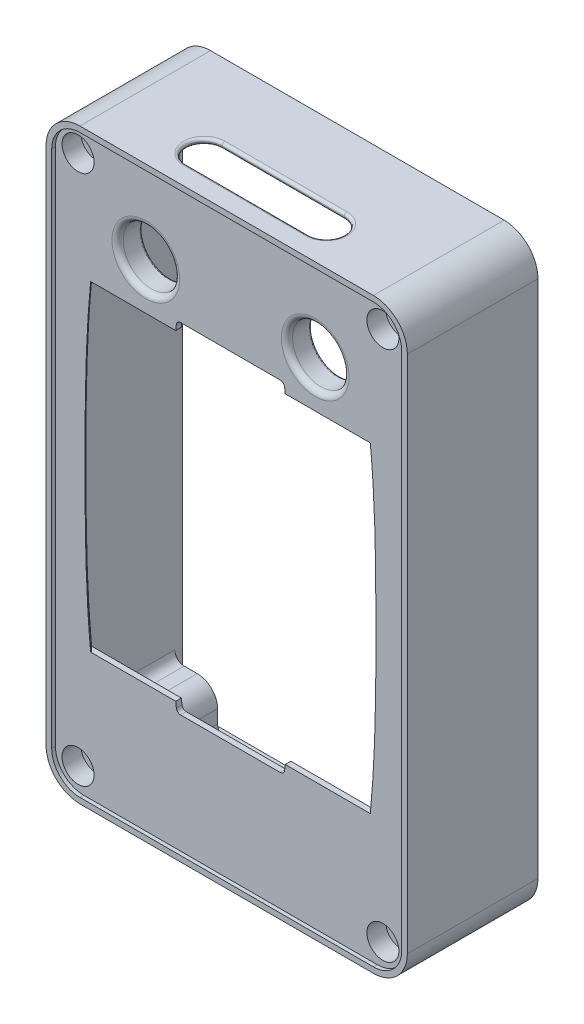
from build123d import *

# Parameters (mm, degrees)
EXTRUDE_THIN1_DEPTH      = 2
EXTRUDE_THIN1_DEPTH_BACK = 67.4
BOSS_EXTRUDE1_START      = -3
BOSS_EXTRUDE1_DEPTH      = 3
CUT_EXTRUDE1_DEPTH       = 196.178789831
BOSS_EXTRUDE2_START      = -63.4
BOSS_EXTRUDE2_DEPTH      = 63.4
SKETCH7_R                = 8.5
CUT_EXTRUDE2_DEPTH       = 10
SKETCH8_R                = 4.5
CUT_EXTRUDE3_DEPTH       = 192.955098916
MIRROR2_START            = -63.4
MIRROR2_COPY_1_DEPTH     = 63.4
MIRROR2_COPY_2_SKETCH_R  = 8.5
MIRROR2_COPY_2_DEPTH     = 10
MIRROR2_COPY_3_SKETCH_R  = 4.5
MIRROR2_COPY_3_DEPTH     = 192.955098916
FILLET1_R                = 5
SKETCH9_R                = 15
CUT_EXTRUDE4_DEPTH       = 30
SKETCH10_R               = 18
SKETCH10_R_2             = 15
BOSS_EXTRUDE3_DEPTH      = 10
FILLET2_R                = 3
CHAMFER1_SIZE            = 2.5
FILLET3_R                = 1
CUT_EXTRUDE5_DEPTH       = 10
FILLET4_R                = 1.5


with BuildPart() as part:
    # Sketch1 → Extrude-Thin1 (new, two sides: drawn at the far end of the back side and taken through both)
    with BuildSketch(Plane.XY.offset(-EXTRUDE_THIN1_DEPTH_BACK)):
        with BuildLine():
            Line((96, -138), (96, 138))
            ThreePointArc((96, 138), (90.727922061, 150.727922061), (78, 156))
            Line((78, 156), (-78, 156))
            ThreePointArc((-78, 156), (-90.727922061, 150.727922061), (-96, 138))
            Line((-96, 138), (-96, -138))
            ThreePointArc((-96, -138), (-90.727922061, -150.727922061), (-78, -156))
            Line((-78, -156), (78, -156))
            ThreePointArc((78, -156), (90.727922061, -150.727922061), (96, -138))
        make_face()
        with BuildLine():
            Line((93, -138), (93, 138))
            ThreePointArc((93, 138), (88.606601718, 148.606601718), (78, 153))
            Line((78, 153), (-78, 153))
            ThreePointArc((-78, 153), (-88.606601718, 148.606601718), (-93, 138))
            Line((-93, 138), (-93, -138))
            ThreePointArc((-93, -138), (-88.606601718, -148.606601718), (-78, -153))
            Line((-78, -153), (78, -153))
            ThreePointArc((78, -153), (88.606601718, -148.606601718), (93, -138))
        make_face(mode=Mode.SUBTRACT)
    extrude(amount=EXTRUDE_THIN1_DEPTH + EXTRUDE_THIN1_DEPTH_BACK)

    # Sketch2 → Boss-Extrude1 (add)
    with BuildSketch(Plane.XY.offset(BOSS_EXTRUDE1_START)):
        with BuildLine():
            Line((-78, -153), (78, -153))
            ThreePointArc((78, -153), (88.606601718, -148.606601718), (93, -138))
            Line((93, -138), (93, 138))
            ThreePointArc((93, 138), (88.606601718, 148.606601718), (78, 153))
            Line((78, 153), (-78, 153))
            ThreePointArc((-78, 153), (-88.606601718, 148.606601718), (-93, 138))
            Line((-93, 138), (-93, -138))
            ThreePointArc((-93, -138), (-88.606601718, -148.606601718), (-78, -153))
        make_face()
    extrude(amount=BOSS_EXTRUDE1_DEPTH)

    # Sketch3 → Cut-Extrude1 (cut, through all)
    with BuildSketch(Plane.XY):
        with BuildLine():
            Line((-26.486425646, -90.3), (26.486744093, -90.299999898))
            ThreePointArc((26.486744093, -90.299999898), (28.018686465, -89.713355324), (28.769359058, -88.254763685))
            Line((28.769359058, -88.254763685), (29.092842195, -85.299999997))
            Line((29.092842195, -85.299999997), (74.323776212, -85.299999479))
            add(Edge.make_bspline(
                [(74.323776212, -85.299999479), (74.664257065, -81.758054802), (74.972523643, -78.21369485), (75.517229034, -71.119589639), (75.755451691, -67.569978124), (76.375603408, -56.914057194), (76.663322985, -49.803573676), (77.058001321, -35.577505512), (77.166220385, -28.461936829), (77.286847677, -14.231427475), (77.299904168, -7.115770874), (77.3, -4.04e-06)],
                knots=[0, 0, 0, 0, 0.125, 0.125, 0.25, 0.25, 0.5, 0.5, 0.75, 0.75, 1, 1, 1, 1], degree=3))
            add(Edge.make_bspline(
                [(77.3, -4.04e-06), (77.29990407, 7.116423452), (77.286848245, 14.232799101), (77.166179901, 28.465172141), (77.057940161, 35.58070197), (76.663178374, 49.807811524), (76.37536408, 56.918515451), (75.755377557, 67.570985118), (75.517087768, 71.119815043), (74.972390534, 78.213181848), (74.664296315, 81.757612422), (74.323779506, 85.299999595)],
                knots=[0, 0, 0, 0, 0.25, 0.25, 0.5, 0.5, 0.75, 0.75, 0.875, 0.875, 1, 1, 1, 1], degree=3))
            Line((74.323779506, 85.299999595), (29.092842195, 85.299999998))
            Line((29.092842195, 85.299999998), (28.769307233, 88.255233671))
            ThreePointArc((28.769307233, 88.255233671), (28.018418083, 89.713595759), (26.486496265, 90.3))
            Line((26.486496265, 90.3), (-26.4866733, 90.299999898))
            ThreePointArc((-26.4866733, 90.299999898), (-28.018618582, 89.713354271), (-28.769291052, 88.254759089))
            Line((-28.769291052, 88.254759089), (-29.092772302, 85.299999997))
            Line((-29.092772302, 85.299999997), (-74.323776212, 85.299999479))
            add(Edge.make_bspline(
                [(-74.323776212, 85.299999479), (-74.664257065, 81.758054802), (-74.972523644, 78.21369485), (-75.517229034, 71.119589639), (-75.755451691, 67.569978124), (-76.375603408, 56.914057194), (-76.663322985, 49.803573676), (-77.058001321, 35.577505511), (-77.166220385, 28.461936828), (-77.286847677, 14.231427475), (-77.299904168, 7.115770874), (-77.3, 4.04e-06)],
                knots=[0, 0, 0, 0, 0.125, 0.125, 0.25, 0.25, 0.5, 0.5, 0.75, 0.75, 1, 1, 1, 1], degree=3))
            add(Edge.make_bspline(
                [(-77.3, 4.04e-06), (-77.29990407, -7.116423452), (-77.286848245, -14.232799101), (-77.166179901, -28.465172141), (-77.057940161, -35.58070197), (-76.663178374, -49.807811524), (-76.37536408, -56.918515451), (-75.755377557, -67.570985118), (-75.517087768, -71.119815043), (-74.972390534, -78.213181848), (-74.664296315, -81.757612422), (-74.323779506, -85.299999595)],
                knots=[0, 0, 0, 0, 0.25, 0.25, 0.5, 0.5, 0.75, 0.75, 0.875, 0.875, 1, 1, 1, 1], degree=3))
            Line((-74.323779506, -85.299999595), (-29.092772302, -85.299999998))
            Line((-29.092772302, -85.299999998), (-28.769239264, -88.255228683))
            ThreePointArc((-28.769239264, -88.255228683), (-28.018350409, -89.713594516), (-26.486425646, -90.3))
        make_face()
    extrude(amount=-CUT_EXTRUDE1_DEPTH, mode=Mode.SUBTRACT)

    # Sketch5 → Boss-Extrude2 (add)
    with BuildSketch(Plane.XY.offset(BOSS_EXTRUDE2_START)):
        with BuildLine():
            Line((70.242640687, -141), (70.242640687, -153))
            Line((70.242640687, -153), (78, -153))
            ThreePointArc((78, -153), (88.606601718, -148.606601718), (93, -138))
            Line((93, -138), (93, -130.242640687))
            Line((93, -130.242640687), (81, -130.242640687))
            ThreePointArc((81, -130.242640687), (73.393398282, -133.393398282), (70.242640687, -141))
        make_face()
    boss_extrude2 = extrude(amount=BOSS_EXTRUDE2_DEPTH)

    # Sketch7 → Cut-Extrude2 (cut)
    with BuildSketch(Plane.XY):
        with Locations((81, -141)):
            Circle(SKETCH7_R)
    cut_extrude2 = extrude(amount=-CUT_EXTRUDE2_DEPTH, mode=Mode.SUBTRACT)

    # Sketch8 → Cut-Extrude3 (cut, through all)
    with BuildSketch(Plane.XY.offset(-10)):
        with Locations((81, -141)):
            Circle(SKETCH8_R)
    cut_extrude3 = extrude(amount=-CUT_EXTRUDE3_DEPTH, mode=Mode.SUBTRACT)

    # Mirror1: Boss-Extrude2, Cut-Extrude2, Cut-Extrude3 across plane
    add(boss_extrude2.mirror(Plane(origin=(0, 0, 0), x_dir=(0, 0, 1), z_dir=(1, 0, 0))))
    add(cut_extrude2.mirror(Plane(origin=(0, 0, 0), x_dir=(0, 0, 1), z_dir=(1, 0, 0))), mode=Mode.SUBTRACT)
    add(cut_extrude3.mirror(Plane(origin=(0, 0, 0), x_dir=(0, 0, 1), z_dir=(1, 0, 0))), mode=Mode.SUBTRACT)

    # Mirror2: Boss-Extrude2, Cut-Extrude2, Cut-Extrude3 across plane
    add(boss_extrude2.mirror(Plane.ZX))
    add(cut_extrude2.mirror(Plane.ZX), mode=Mode.SUBTRACT)
    add(cut_extrude3.mirror(Plane.ZX), mode=Mode.SUBTRACT)

    # Mirror2 copy 1 sketch → Mirror2 copy 1 (add)
    with BuildSketch(Plane(origin=(0, 0, 0), x_dir=(-1, 0, 0), z_dir=(0, 0, 1)).offset(MIRROR2_START)):
        with BuildLine():
            Line((70.242640687, -141), (70.242640687, -153))
            Line((70.242640687, -153), (78, -153))
            ThreePointArc((78, -153), (88.606601718, -148.606601718), (93, -138))
            Line((93, -138), (93, -130.242640687))
            Line((93, -130.242640687), (81, -130.242640687))
            ThreePointArc((81, -130.242640687), (73.393398282, -133.393398282), (70.242640687, -141))
        make_face()
    extrude(amount=MIRROR2_COPY_1_DEPTH)

    # Mirror2 copy 2 sketch → Mirror2 copy 2 (cut)
    with BuildSketch(Plane(origin=(0, 0, 0), x_dir=(-1, 0, 0), z_dir=(0, 0, 1))):
        with Locations((81, -141)):
            Circle(MIRROR2_COPY_2_SKETCH_R)
    extrude(amount=-MIRROR2_COPY_2_DEPTH, mode=Mode.SUBTRACT)

    # Mirror2 copy 3 sketch → Mirror2 copy 3 (cut, through all)
    with BuildSketch(Plane(origin=(0, 0, -10), x_dir=(-1, 0, 0), z_dir=(0, 0, 1))):
        with Locations((81, -141)):
            Circle(MIRROR2_COPY_3_SKETCH_R)
    extrude(amount=-MIRROR2_COPY_3_DEPTH, mode=Mode.SUBTRACT)

    # Fillet1
    fillet1_edges = [part.edges().sort_by_distance(p)[0] for p in [
        (93, -130.242640687, -33.2),
        (70.242640687, -153, -33.2),
        (-93, -130.242640687, -33.2),
        (-70.242640687, -153, -33.2),
        (-93, 130.242640687, -33.2),
        (-70.242640687, 153, -33.2),
        (93, 130.242640687, -33.2),
        (70.242640687, 153, -33.2),
    ]]
    fillet(fillet1_edges, radius=FILLET1_R)

    # Sketch9 → Cut-Extrude4 (cut)
    with BuildSketch(Plane.XY):
        with Locations((-45, 110)):
            Circle(SKETCH9_R)
    cut_extrude4 = extrude(amount=-CUT_EXTRUDE4_DEPTH, mode=Mode.SUBTRACT)

    # Mirror3: Cut-Extrude4 across plane
    add(cut_extrude4.mirror(Plane(origin=(0, 0, 0), x_dir=(0, 0, 1), z_dir=(1, 0, 0))), mode=Mode.SUBTRACT)

    # Sketch10 → Boss-Extrude3 (add)
    with BuildSketch(Plane(origin=(0, 0, -3), x_dir=(-1, 0, 0), z_dir=(0, 0, -1))):
        with Locations(Location((45, 110, 0), (0, 0, 180))):
            Circle(SKETCH10_R)
        with Locations(Location((45, 110, 0), (0, 0, 180))):
            Circle(SKETCH10_R_2, mode=Mode.SUBTRACT)
    boss_extrude3 = extrude(amount=BOSS_EXTRUDE3_DEPTH)

    # Mirror4: Boss-Extrude3 across plane
    add(boss_extrude3.mirror(Plane(origin=(0, 0, 0), x_dir=(0, 0, 1), z_dir=(1, 0, 0))))

    # Fillet2
    fillet2_edges = [part.edges().sort_by_distance(p)[0] for p in [
        (-60, 110, 0),
        (60, 110, 0),
    ]]
    fillet(fillet2_edges, radius=FILLET2_R - 0.0001)  # a hair under: the kernel refuses the full size

    # Chamfer1
    chamfer1_edges = [part.edges().sort_by_distance(p)[0] for p in [
        (76.86067262, 42.690170862, -3),
        (76.860672252, -42.690176488, -3),
        (-76.860672252, 42.690176488, -3),
        (-76.86067262, -42.690170862, -3),
    ]]
    chamfer(chamfer1_edges, length=CHAMFER1_SIZE)

    # Fillet3
    fillet3_edges = [part.edges().sort_by_distance(p)[0] for p in [
        (-63, 110, -13),
        (-60, 110, -13),
        (63, 110, -13),
        (60, 110, -13),
    ]]
    fillet(fillet3_edges, radius=FILLET3_R)

    # Sketch11 → Cut-Extrude5 (cut)
    with BuildSketch(Plane(origin=(0, 156, 0), x_dir=(1, 0, 0), z_dir=(0, 1, 0))):
        with BuildLine():
            Line((32.5, 28), (-32.5, 28))
            ThreePointArc((-32.5, 28), (-42, 18.5), (-32.5, 9))
            Line((-32.5, 9), (32.5, 9))
            ThreePointArc((32.5, 9), (42, 18.5), (32.5, 28))
        make_face()
    extrude(amount=-CUT_EXTRUDE5_DEPTH, mode=Mode.SUBTRACT)

    # Fillet4
    fillet4_edges = [part.edges().sort_by_distance(p)[0] for p in [
        (42, 153, -18.5),
        (0, 153, -9),
        (-42, 153, -18.5),
        (42, 156, -18.5),
        (0, 156, -9),
        (-42, 156, -18.5),
        (0, 153, -28),
        (0, 156, -28),
    ]]
    fillet(fillet4_edges, radius=FILLET4_R - 0.0001)  # a hair under: the kernel refuses the full size


solid = part.part
